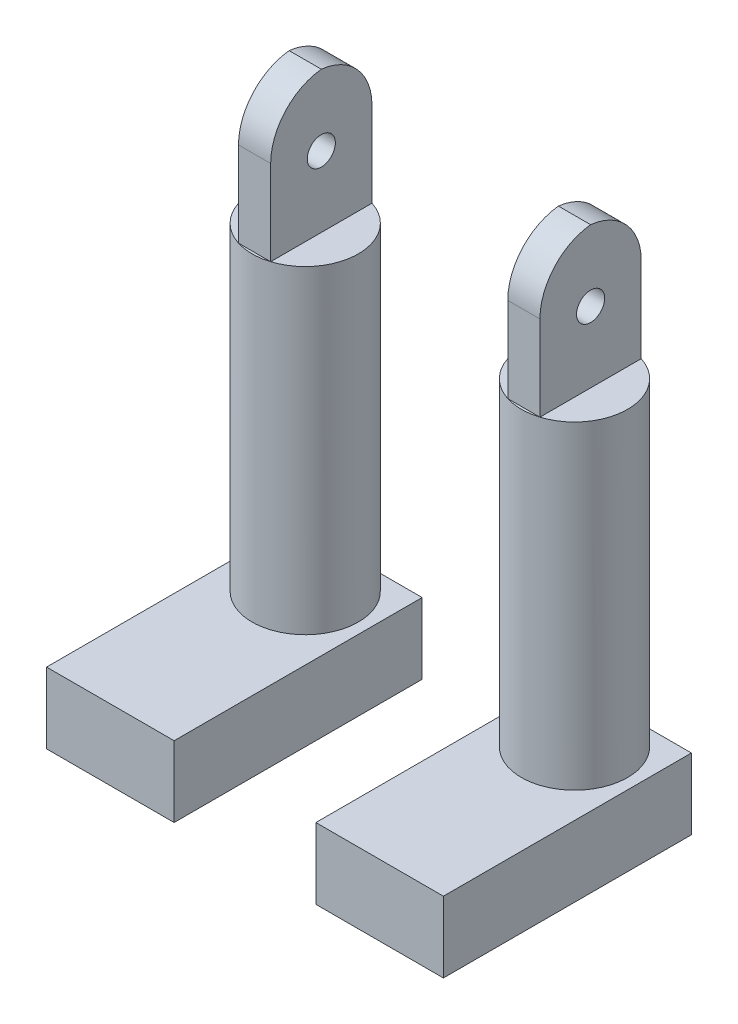
from build123d import *

# Parameters (mm, degrees)
SKETCH1_W             = 180
SKETCH1_H             = 350
BOSS_EXTRUDE1_DEPTH   = 100
BOSS_EXTRUDE1_2_DEPTH = 100
SKETCH2_R             = 75
BOSS_EXTRUDE2_DEPTH   = 450
SKETCH3_W             = 45.419423784
SKETCH3_H             = 142.958301414
BOSS_EXTRUDE3_DEPTH   = 200
FILLET1_R             = 80
FILLET2_R             = 80
SKETCH4_R             = 19.812422485
CUT_EXTRUDE1_DEPTH    = 579


with BuildPart() as part:
    # Sketch1 → Boss-Extrude1 (new body)
    with BuildSketch(Plane(origin=(0, 0, 0), x_dir=(1, 0, 0), z_dir=(0, 1, 0))):
        with Locations((-540, 0)):
            Rectangle(SKETCH1_W, SKETCH1_H)
    extrude(amount=BOSS_EXTRUDE1_DEPTH)



with BuildPart() as body_2:
    # Sketch1 → Boss-Extrude1 2 (new body)
    with BuildSketch(Plane(origin=(0, 0, 0), x_dir=(1, 0, 0), z_dir=(0, 1, 0))):
        with Locations((-160, 0)):
            Rectangle(SKETCH1_W, SKETCH1_H)
    extrude(amount=BOSS_EXTRUDE1_2_DEPTH)


with BuildPart() as part_1:
    add(part.part)

    add(body_2.part)  # Boss-Extrude2 merges body 2
    # Sketch2 → Boss-Extrude2 (add)
    with BuildSketch(Plane(origin=(0, 100, 0), x_dir=(1, 0, 0), z_dir=(0, 1, 0))):
        with Locations(Location((-540, 100, 0), (0, 0, 90))):
            Circle(SKETCH2_R)
        with Locations(Location((-160, 100, 0), (0, 0, 90))):
            Circle(SKETCH2_R)
    extrude(amount=BOSS_EXTRUDE2_DEPTH)

    # Sketch3 → Boss-Extrude3 (add)
    with BuildSketch(Plane(origin=(0, 550, 0), x_dir=(1, 0, 0), z_dir=(0, 1, 0))):
        with Locations((-540, 100)):
            Rectangle(SKETCH3_W, SKETCH3_H)
        with Locations((-160, 100)):
            Rectangle(SKETCH3_W, SKETCH3_H)
    extrude(amount=BOSS_EXTRUDE3_DEPTH)

    # Fillet1
    # the kernel refuses this fillet: 80 mm, written as the material it takes off along each edge
    with BuildSketch(Plane(origin=(-317.290288108, 750, -171.479150707), x_dir=(0, -1, 0), z_dir=(-1, 0, 0)), Plane(origin=(-762.709711892, 750, -28.520849293), x_dir=(0, -1, 0), z_dir=(1, 0, 0))) as fillet1_piece_1:
        with BuildLine():
            CenterArc((FILLET1_R, FILLET1_R), FILLET1_R, 180, 90)
            Line((0, FILLET1_R), (0, 0))
            Line((0, 0), (FILLET1_R, 0))
        make_face()
    extrude(amount=445.419423783, mode=Mode.SUBTRACT)

    # Fillet2
    # the kernel refuses this fillet: 80 mm, written as the material it takes off along each edge
    with BuildSketch(Plane(origin=(62.709711892, 750, -171.479150707), x_dir=(0, -1, 0), z_dir=(-1, 0, 0)), Plane(origin=(-382.709711892, 750, -28.520849293), x_dir=(0, -1, 0), z_dir=(1, 0, 0))) as fillet2_piece_1:
        with BuildLine():
            CenterArc((FILLET2_R, FILLET2_R), FILLET2_R, 180, 90)
            Line((0, FILLET2_R), (0, 0))
            Line((0, 0), (FILLET2_R, 0))
        make_face()
    extrude(amount=445.419423783, mode=Mode.SUBTRACT)

    # Sketch4 → Cut-Extrude1 (cut)
    with BuildSketch(Plane(origin=(-137.290288108, 0, 0), x_dir=(0, 0, -1), z_dir=(1, 0, 0))):
        with Locations((100, 649.772462607)):
            Circle(SKETCH4_R)
    extrude(amount=-CUT_EXTRUDE1_DEPTH, mode=Mode.SUBTRACT)


solid = part_1.part
